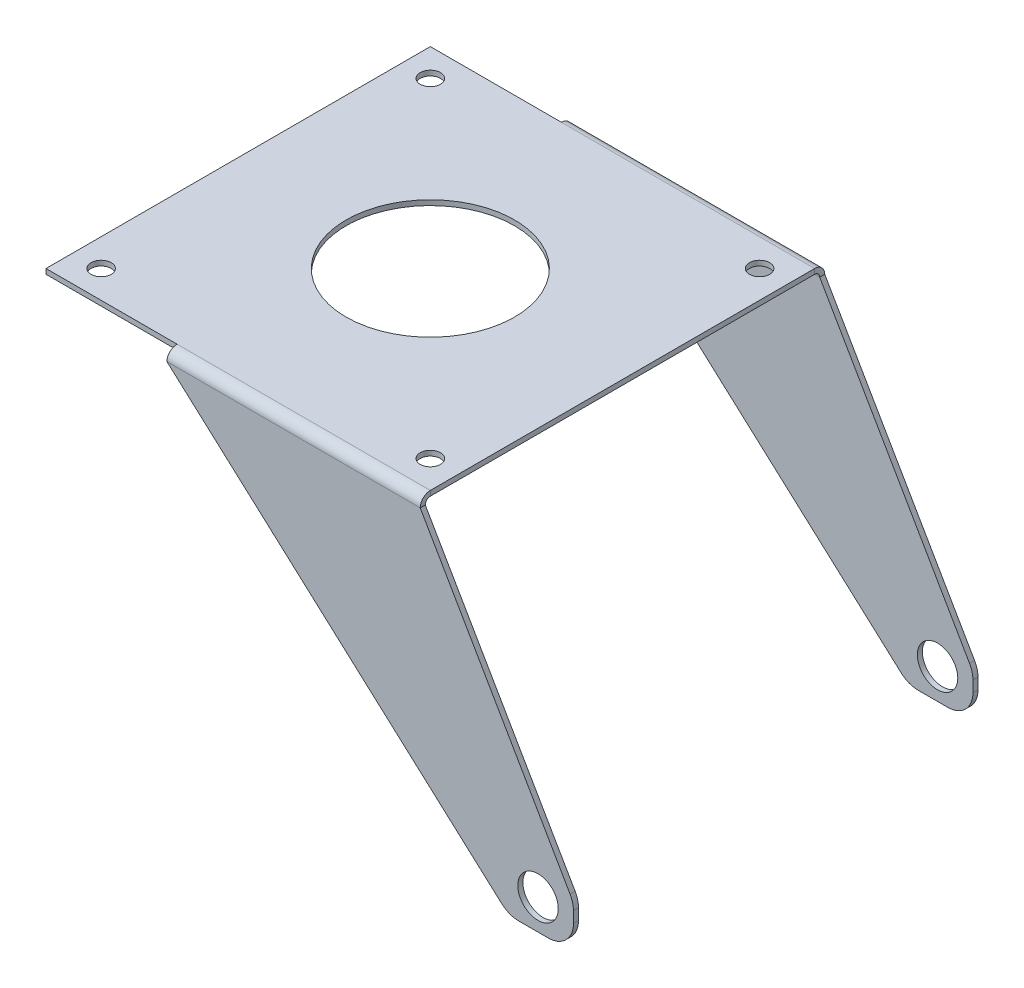
from build123d import *

# Parameters (mm, degrees)
SKETCH2_W            = 76
SKETCH2_H            = 76
BASE_FLANGE1_DEPTH   = 1
SKETCH7_R            = 2
SKETCH7_R_2          = 16.65
CUT_EXTRUDE2_DEPTH   = 10
CIRPATTERN1_COUNT    = 4
EDGE_FLANGE1_DEPTH   = 50.083809579
SKETCH14_W           = 30.3
SKETCH14_H           = 61
TAB1_DEPTH           = 1
FILLET1_R            = 5
CUT_EXTRUDE4_DEPTH   = 10
CUT_EXTRUDE5_DEPTH   = 10
FILLET2_R            = 5
SKETCH19_R           = 4
CUT_EXTRUDE6_DEPTH   = 10
FILLET1_OF_MIRROR1_R = 5
FILLET2_OF_MIRROR1_R = 5


# Sheet-metal steps are written as plain solids
with BuildPart() as part:
    # Sketch2 → Base-Flange1 (new body)
    with BuildSketch(Plane(origin=(0, 0, 0), x_dir=(1, 0, 0), z_dir=(0, 1, 0))):
        Rectangle(SKETCH2_W, SKETCH2_H)
    extrude(amount=-BASE_FLANGE1_DEPTH)

    # Sketch7 → Cut-Extrude2 (cut)
    with BuildSketch(Plane(origin=(0, 0, 0), x_dir=(1, 0, 0), z_dir=(0, 1, 0))):
        with Locations(Location((32.55, 32.55, 0), (0, 0, 270))):
            Circle(SKETCH7_R)
        with Locations(Location((0, 0, 0), (0, 0, 270))):
            Circle(SKETCH7_R_2)
    cut_extrude2 = extrude(amount=-CUT_EXTRUDE2_DEPTH, mode=Mode.SUBTRACT)

    # CirPattern1: Cut-Extrude2 ×4 about axis
    cirpattern1_axis = Axis((0, 0, 0), (0, 1, 0))
    for i in range(1, CIRPATTERN1_COUNT):
        add(cut_extrude2.rotate(cirpattern1_axis, i * 360 / CIRPATTERN1_COUNT), mode=Mode.SUBTRACT)

    # Edge-Flange1 section (across the edge) → Edge-Flange1 (add)
    with BuildSketch(Plane(origin=(-12.083809579, -1, -39), x_dir=(0, 0, 1), z_dir=(1, 0, 0))):
        with BuildLine():
            Line((-1, 1), (-1, 62))
            Line((-1, 62), (0, 62))
            Line((0, 62), (0, 1))
            ThreePointArc((0, 1), (0.292893219, 0.292893219), (1, 0))
            Line((1, 0), (1, -1))
            ThreePointArc((1, -1), (-0.414213562, -0.414213562), (-1, 1))
        make_face()
    edge_flange1 = extrude(amount=EDGE_FLANGE1_DEPTH)

    # Sketch14 → Tab1 (add)
    with BuildSketch(Plane(origin=(0, 0, -40), x_dir=(-1, 0, 0), z_dir=(0, 0, -1))):
        with Locations((-53.15, -32.5)):
            Rectangle(SKETCH14_W, SKETCH14_H)
    tab1 = extrude(amount=-TAB1_DEPTH)

    # Fillet1
    fillet1_edges = [part.edges().sort_by_distance(p)[0] for p in [
        (68.3, -63, -39.5),
    ]]
    fillet(fillet1_edges, radius=FILLET1_R)

    # Sketch20 → Cut-Extrude4 (cut)
    with BuildSketch(Plane(origin=(0, 0, -40), x_dir=(-1, 0, 0), z_dir=(0, 0, -1))):
        Polygon((-38, -2), (-68.3, -54.482600826), (-68.3, -2), align=None)
    cut_extrude4 = extrude(amount=-CUT_EXTRUDE4_DEPTH, mode=Mode.SUBTRACT)

    # Sketch21 → Cut-Extrude5 (cut)
    with BuildSketch(Plane(origin=(0, 0, -40), x_dir=(-1, 0, 0), z_dir=(0, 0, -1))):
        Polygon((12.083809579, -2), (-55.544985759, -63), (12.083809579, -63), align=None)
    cut_extrude5 = extrude(amount=-CUT_EXTRUDE5_DEPTH, mode=Mode.SUBTRACT)

    # Fillet2
    fillet2_edges = [part.edges().sort_by_distance(p)[0] for p in [
        (55.544985759, -63, -39.5),
        (68.3, -54.482600826, -39.5),
    ]]
    fillet(fillet2_edges, radius=FILLET2_R)

    # Sketch19 → Cut-Extrude6 (cut)
    with BuildSketch(Plane(origin=(0, 0, -40), x_dir=(-1, 0, 0), z_dir=(0, 0, -1))):
        with Locations(Location((-61.3, -57, 0), (0, 0, 90))):
            Circle(SKETCH19_R)
    cut_extrude6 = extrude(amount=-CUT_EXTRUDE6_DEPTH, mode=Mode.SUBTRACT)

    # Mirror1: Edge-Flange1, Tab1, Cut-Extrude4, Cut-Extrude5, Cut-Extrude6 across plane
    add(edge_flange1.mirror(Plane.XY))
    add(tab1.mirror(Plane.XY))
    add(cut_extrude4.mirror(Plane.XY), mode=Mode.SUBTRACT)
    add(cut_extrude5.mirror(Plane.XY), mode=Mode.SUBTRACT)
    add(cut_extrude6.mirror(Plane.XY), mode=Mode.SUBTRACT)

    # Fillet1 of Mirror1
    fillet1_of_mirror1_edges = [part.edges().sort_by_distance(p)[0] for p in [
        (68.3, -63, 39.5),
    ]]
    fillet(fillet1_of_mirror1_edges, radius=FILLET1_OF_MIRROR1_R)

    # Fillet2 of Mirror1
    fillet2_of_mirror1_edges = [part.edges().sort_by_distance(p)[0] for p in [
        (55.544985759, -63, 39.5),
        (68.3, -54.482600826, 39.5),
    ]]
    fillet(fillet2_of_mirror1_edges, radius=FILLET2_OF_MIRROR1_R)


solid = part.part
